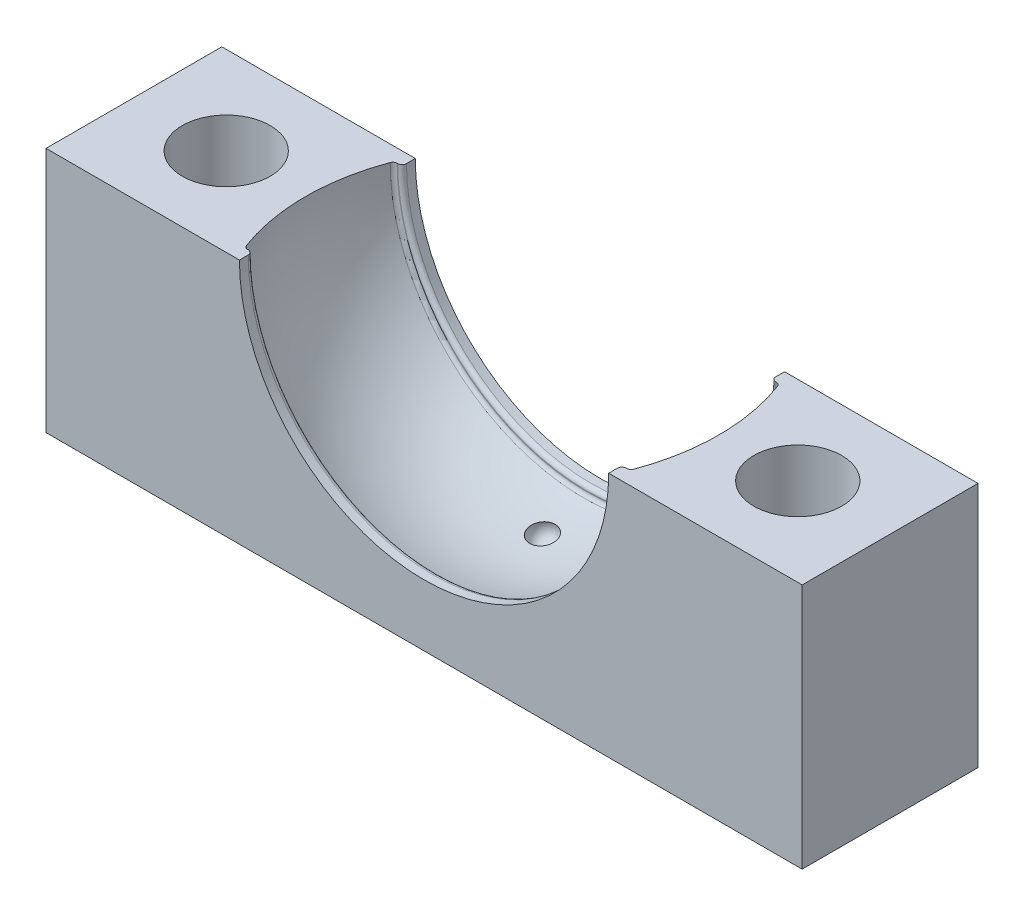
from build123d import *

# Parameters (mm, degrees)
SKETCH1_W           = 86
SKETCH1_H           = 28
BOSS_EXTRUDE1_DEPTH = 20
SKETCH2_R           = 5
CUT_EXTRUDE1_DEPTH  = 56.072679252
FILLET1_R           = 0.5
FILLET2_R           = 0.5


with BuildPart() as part:
    # Sketch1 → Boss-Extrude1 (new body)
    with BuildSketch(Plane.XY):
        with Locations((0, 14)):
            Rectangle(SKETCH1_W, SKETCH1_H)
    extrude(amount=BOSS_EXTRUDE1_DEPTH)

    # Sketch2 → Cut-Extrude1 (cut, through all)
    with BuildSketch(Plane(origin=(0, 0, 0), x_dir=(1, 0, 0), z_dir=(0, 1, 0))):
        with Locations((-32.5, -10)):
            Circle(SKETCH2_R)
        with Locations((32.5, -10)):
            Circle(SKETCH2_R)
    extrude(amount=CUT_EXTRUDE1_DEPTH, mode=Mode.SUBTRACT)

    # Sketch4 → Cut-Revolve1 (revolve, cut)
    with BuildSketch(Plane(origin=(0, 28, 0), x_dir=(-1, 0, 0), z_dir=(0, 1, 0))):
        with BuildLine():
            Line((0, 0), (0, 20))
            Line((0, 20), (21, 20))
            Line((21, 20), (21, 18.5))
            Line((21, 18.5), (21.9089023, 18.5))
            ThreePointArc((21.9089023, 18.5), (23.5, 10), (21.9089023, 1.5))
            Line((21.9089023, 1.5), (21, 1.5))
            Line((21, 1.5), (21, 0))
            Line((21, 0), (0, 0))
        make_face()
    revolve(axis=Axis((0, 28, 0), (0, 0, 1)), mode=Mode.SUBTRACT)

    # Sketch5 → Cut-Revolve2 (revolve, cut)
    with BuildSketch(Plane(origin=(0, 4.5, 0), x_dir=(1, 0, 0), z_dir=(0, 1, 0))):
        with BuildLine():
            Line((0, -5), (0, -8))
            ThreePointArc((0, -8), (-1.5, -6.5), (0, -5))
        make_face()
    revolve(axis=Axis((0, 4.5, 0), (0, 0, 1)), mode=Mode.SUBTRACT)

    # Fillet1
    fillet1_edges = [part.edges().sort_by_distance(p)[0] for p in [
        (0, 6.0910977, 1.5),
        (0, 6.0910977, 18.5),
    ]]
    fillet(fillet1_edges, radius=FILLET1_R)

    # Fillet2
    fillet2_edges = [part.edges().sort_by_distance(p)[0] for p in [
        (0, 7, 18.5),
        (0, 7, 1.5),
    ]]
    fillet(fillet2_edges, radius=FILLET2_R)


solid = part.part
